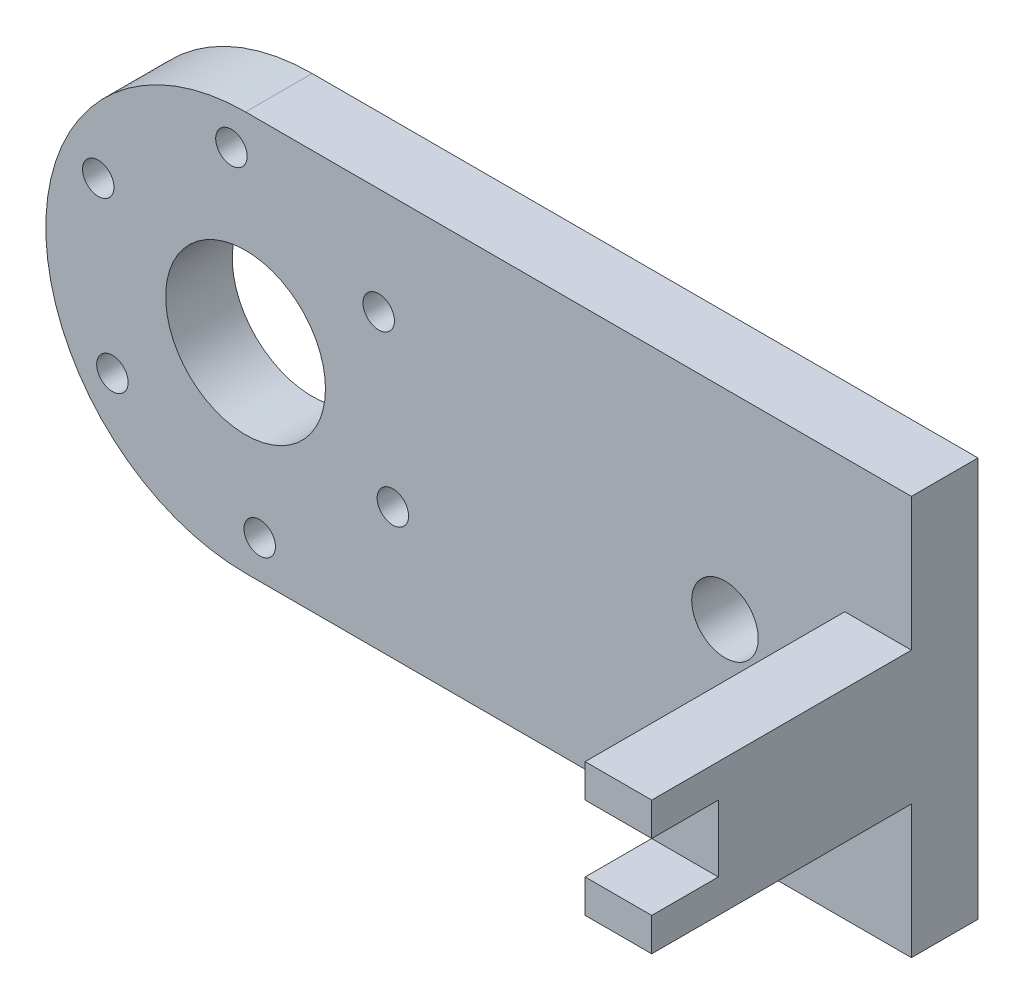
from build123d import *

# Parameters (mm, degrees)
SKETCH1_R           = 19.05
SKETCH1_W           = 63.5
SKETCH1_H           = 38.1
BOSS_EXTRUDE1_DEPTH = 6.35
SKETCH2_R           = 7.62
SKETCH2_R_2         = 1.5
CUT_EXTRUDE1_DEPTH  = 67.599361859
SKETCH4_W           = 6.35
SKETCH4_H           = 24.765
BOSS_EXTRUDE2_DEPTH = 6.35
CUT_EXTRUDE2_REACH  = 92.253
SKETCH5_W           = 6.35
SKETCH5_H           = 6.35
CUT_EXTRUDE3_REACH  = 75.235
SKETCH6_R           = 3.175


with BuildPart() as part:
    # Sketch1 → Boss-Extrude1 (new body)
    with BuildSketch(Plane.XY):
        Circle(SKETCH1_R)
        with Locations((31.75, 0)):
            Rectangle(SKETCH1_W, SKETCH1_H)
    extrude(amount=BOSS_EXTRUDE1_DEPTH)

    # Sketch2 → Cut-Extrude1 (cut, through all)
    with BuildSketch(Plane.XY.offset(6.35)):
        Circle(SKETCH2_R)
        with Locations((-1.350914013, 15.44101782)):
            Circle(SKETCH2_R_2)
        with Locations((12.696856686, 8.890434763)):
            Circle(SKETCH2_R_2)
        with Locations((14.047770699, -6.550583057)):
            Circle(SKETCH2_R_2)
        with Locations((1.350914013, -15.44101782)):
            Circle(SKETCH2_R_2)
        with Locations((-12.696856686, -8.890434763)):
            Circle(SKETCH2_R_2)
        with Locations((-14.047770699, 6.550583057)):
            Circle(SKETCH2_R_2)
    extrude(amount=-CUT_EXTRUDE1_DEPTH, mode=Mode.SUBTRACT)

    # Sketch4 → Boss-Extrude2 (add, symmetric)
    with BuildSketch(Plane(origin=(0, 0, 0), x_dir=(1, 0, 0), z_dir=(0, 1, 0))):
        with Locations((60.325, -18.7325)):
            Rectangle(SKETCH4_W, SKETCH4_H)
    extrude(amount=BOSS_EXTRUDE2_DEPTH, both=True)

    # Sketch5 → Cut-Extrude2 (cut, up to next)
    with BuildSketch(Plane(origin=(63.5, 0, 0), x_dir=(0, 0, -1), z_dir=(1, 0, 0)), mode=Mode.PRIVATE) as cut_extrude2_sk1:
        with Locations((-27.94, 0)):
            Rectangle(SKETCH5_W, SKETCH5_H)
    cut_extrude2_tool1 = extrude(cut_extrude2_sk1.sketch, amount=-CUT_EXTRUDE2_REACH, mode=Mode.PRIVATE) & part.part
    add(cut_extrude2_tool1.solids().sort_by_distance((63.5, 0, 27.94))[0], mode=Mode.SUBTRACT)

    # Sketch6 → Cut-Extrude3 (cut, up to next)
    with BuildSketch(Plane(origin=(0, 0, 0), x_dir=(-1, 0, 0), z_dir=(0, 0, -1)), mode=Mode.PRIVATE) as cut_extrude3_sk1:
        with Locations((-45.72, 0)):
            Circle(SKETCH6_R)
    cut_extrude3_tool1 = extrude(cut_extrude3_sk1.sketch, amount=-CUT_EXTRUDE3_REACH, mode=Mode.PRIVATE) & part.part
    add(cut_extrude3_tool1.solids().sort_by_distance((45.72, 0, 0))[0], mode=Mode.SUBTRACT)


solid = part.part
